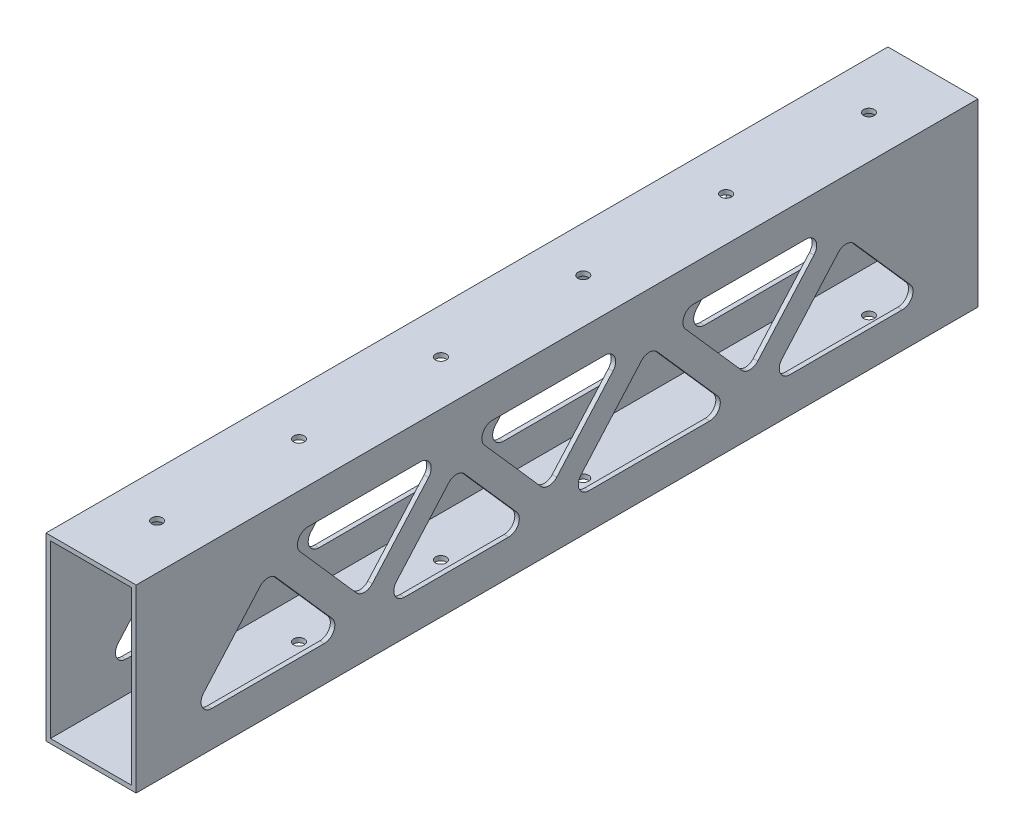
from build123d import *

# Parameters (mm, degrees)
SKETCH1_W           = 25.4
SKETCH1_H           = 50.8
SKETCH1_W_2         = 22.86
SKETCH1_H_2         = 48.26
BOSS_EXTRUDE1_DEPTH = 237.2995
CUT_EXTRUDE1_DEPTH  = 242.549111961
FILLET1_R           = 3
MIRROR1_START       = -91.227065342
MIRROR1_DEPTH       = 1.27
SKETCH6_R           = 1.5
CUT_EXTRUDE2_DEPTH  = 269.69861411


# Read off the part's stored shape, not the designer's step: Mirror1
with BuildPart() as part:
    # Sketch1 → Boss-Extrude1 (new body)
    with BuildSketch(Plane.XY):
        with Locations((-102.657065342, -11.879495554)):
            Rectangle(SKETCH1_W, SKETCH1_H)
        with Locations((-102.657065342, -11.879495554)):
            Rectangle(SKETCH1_W_2, SKETCH1_H_2, mode=Mode.SUBTRACT)
    extrude(amount=BOSS_EXTRUDE1_DEPTH)

    # Sketch5 → Cut-Extrude1 (cut, through all)
    with BuildSketch(Plane.ZY.offset(115.357065342)):
        Polygon((59.65825413, -27.279495554), (37.1624375, -1.771064943), (14.66662087, -27.279495554), align=None)
        Polygon((68.99149587, -27.279495554), (92.653967718, -0.448172595), (116.316439565, -27.279495554), align=None)
        Polygon((98.487243806, 3.520504446), (143.478877065, 3.520504446), (120.983060435, -21.987926165), align=None)
        Polygon((125.649681306, -27.279495554), (146.978842718, -3.09395729), (168.30800413, -27.279495554), align=None)
        Polygon((150.47880837, 3.520504446), (195.47044163, 3.520504446), (172.974625, -21.987926165), align=None)
        Polygon((177.64124587, -27.279495554), (200.1370625, -1.771064943), (222.63287913, -27.279495554), align=None)
        Polygon((41.82905837, 3.520504446), (86.82069163, 3.520504446), (64.324875, -21.987926165), align=None)
    extrude(amount=-CUT_EXTRUDE1_DEPTH, mode=Mode.SUBTRACT)

    # Fillet1
    fillet1_edges = [part.edges().sort_by_distance(p)[0] for p in [
        (-114.722065342, 3.520504446, 41.82905837),
        (-114.722065342, 3.520504446, 86.82069163),
        (-114.722065342, -21.987926165, 64.324875),
        (-114.722065342, -1.771064943, 37.1624375),
        (-114.722065342, -27.279495554, 59.65825413),
        (-114.722065342, -27.279495554, 14.66662087),
        (-114.722065342, -27.279495554, 125.649681306),
        (-114.722065342, -3.09395729, 146.978842718),
        (-114.722065342, -27.279495554, 168.30800413),
        (-114.722065342, 3.520504446, 150.47880837),
        (-114.722065342, 3.520504446, 195.47044163),
        (-114.722065342, -21.987926165, 172.974625),
        (-114.722065342, -27.279495554, 68.99149587),
        (-114.722065342, -0.448172595, 92.653967718),
        (-114.722065342, -27.279495554, 116.316439565),
        (-114.722065342, 3.520504446, 98.487243806),
        (-114.722065342, 3.520504446, 143.478877065),
        (-114.722065342, -21.987926165, 120.983060435),
        (-114.722065342, -27.279495554, 177.64124587),
        (-114.722065342, -1.771064943, 200.1370625),
        (-114.722065342, -27.279495554, 222.63287913),
    ]]
    fillet(fillet1_edges, radius=FILLET1_R)

    # Mirror1 outline → Mirror1 (add)
    with BuildSketch(Plane.YZ.offset(MIRROR1_START)):
        with BuildLine():
            ThreePointArc((-19.436583706, 170.724602919), (-20.45229526, 172.974625), (-19.436583706, 175.224647081))
            Line((-19.436583706, 175.224647081), (-21.987926165, 172.974625))
            Line((-21.987926165, 172.974625), (-19.436583706, 170.724602919))
        make_face()
        with BuildLine():
            Line((3.520504446, 195.47044163), (-1.463784, 191.074811))
            ThreePointArc((-1.463784, 191.074811), (1.754833143, 191.559095535), (3.520504446, 188.824788919))
            Line((3.520504446, 188.824788919), (3.520504446, 195.47044163))
        make_face()
        with BuildLine():
            ThreePointArc((3.520504446, 157.124461081), (1.754833143, 154.390154465), (-1.463784, 154.874439))
            Line((-1.463784, 154.874439), (3.520504446, 150.47880837))
            Line((3.520504446, 150.47880837), (3.520504446, 157.124461081))
        make_face()
        with BuildLine():
            Line((3.520504446, 143.478877065), (-1.463784, 139.083246435))
            ThreePointArc((-1.463784, 139.083246435), (1.754833143, 139.56753097), (3.520504446, 136.833224354))
            Line((3.520504446, 136.833224354), (3.520504446, 143.478877065))
        make_face()
        with BuildLine():
            ThreePointArc((-19.436583706, 118.733038355), (-20.45229526, 120.983060435), (-19.436583706, 123.233082516))
            Line((-19.436583706, 123.233082516), (-21.987926165, 120.983060435))
            Line((-21.987926165, 120.983060435), (-19.436583706, 118.733038355))
        make_face()
        with BuildLine():
            Line((3.520504446, 98.487243806), (3.520504446, 105.132896516))
            ThreePointArc((3.520504446, 105.132896516), (1.754833143, 102.3985899), (-1.463784, 102.882874435))
            Line((-1.463784, 102.882874435), (3.520504446, 98.487243806))
        make_face()
        with BuildLine():
            Line((-27.279495554, 125.649681306), (-22.295207108, 130.045311935))
            ThreePointArc((-22.295207108, 130.045311935), (-25.513824251, 129.5610274), (-27.279495554, 132.295334016))
            Line((-27.279495554, 132.295334016), (-27.279495554, 125.649681306))
        make_face()
        with BuildLine():
            ThreePointArc((-5.645299749, 149.228864798), (-4.629588195, 146.978842718), (-5.645299749, 144.728820637))
            Line((-5.645299749, 144.728820637), (-3.09395729, 146.978842718))
            Line((-3.09395729, 146.978842718), (-5.645299749, 149.228864798))
        make_face()
        with BuildLine():
            Line((-27.279495554, 168.30800413), (-27.279495554, 161.662351419))
            ThreePointArc((-27.279495554, 161.662351419), (-25.513824251, 164.396658035), (-22.295207108, 163.9123735))
            Line((-22.295207108, 163.9123735), (-27.279495554, 168.30800413))
        make_face()
        with BuildLine():
            Line((-27.279495554, 177.64124587), (-22.295207108, 182.0368765))
            ThreePointArc((-22.295207108, 182.0368765), (-25.513824251, 181.552591965), (-27.279495554, 184.286898581))
            Line((-27.279495554, 184.286898581), (-27.279495554, 177.64124587))
        make_face()
        with BuildLine():
            ThreePointArc((-4.322407402, 202.387084581), (-3.306695848, 200.1370625), (-4.322407402, 197.887040419))
            Line((-4.322407402, 197.887040419), (-1.771064943, 200.1370625))
            Line((-1.771064943, 200.1370625), (-4.322407402, 202.387084581))
        make_face()
        with BuildLine():
            Line((-27.279495554, 222.63287913), (-27.279495554, 215.987226419))
            ThreePointArc((-27.279495554, 215.987226419), (-25.513824251, 218.721533035), (-22.295207108, 218.2372485))
            Line((-22.295207108, 218.2372485), (-27.279495554, 222.63287913))
        make_face()
        with BuildLine():
            Line((-27.279495554, 116.316439565), (-27.279495554, 109.670786854))
            ThreePointArc((-27.279495554, 109.670786854), (-25.513824251, 112.40509347), (-22.295207108, 111.920808935))
            Line((-22.295207108, 111.920808935), (-27.279495554, 116.316439565))
        make_face()
        with BuildLine():
            ThreePointArc((-22.295207108, 73.3871265), (-25.513824251, 72.902841965), (-27.279495554, 75.637148581))
            Line((-27.279495554, 75.637148581), (-27.279495554, 68.99149587))
            Line((-27.279495554, 68.99149587), (-22.295207108, 73.3871265))
        make_face()
        with BuildLine():
            Line((-0.448172595, 92.653967718), (-2.999515054, 94.903989798))
            ThreePointArc((-2.999515054, 94.903989798), (-1.9838035, 92.653967717), (-2.999515054, 90.403945637))
            Line((-2.999515054, 90.403945637), (-0.448172595, 92.653967718))
        make_face()
        with BuildLine():
            Line((3.520504446, 86.82069163), (-1.463784, 82.425061))
            ThreePointArc((-1.463784, 82.425061), (1.754833143, 82.909345535), (3.520504446, 80.175038919))
            Line((3.520504446, 80.175038919), (3.520504446, 86.82069163))
        make_face()
        with BuildLine():
            ThreePointArc((-19.436583706, 62.074852919), (-20.45229526, 64.324875), (-19.436583706, 66.574897081))
            Line((-19.436583706, 66.574897081), (-21.987926165, 64.324875))
            Line((-21.987926165, 64.324875), (-19.436583706, 62.074852919))
        make_face()
        with BuildLine():
            Line((3.520504446, 41.82905837), (3.520504446, 48.474711081))
            ThreePointArc((3.520504446, 48.474711081), (1.754833143, 45.740404465), (-1.463784, 46.224689))
            Line((-1.463784, 46.224689), (3.520504446, 41.82905837))
        make_face()
        with BuildLine():
            ThreePointArc((-27.279495554, 53.012601419), (-25.513824251, 55.746908035), (-22.295207108, 55.2626235))
            Line((-22.295207108, 55.2626235), (-27.279495554, 59.65825413))
            Line((-27.279495554, 59.65825413), (-27.279495554, 53.012601419))
        make_face()
        with BuildLine():
            Line((-1.771064943, 37.1624375), (-4.322407402, 39.412459581))
            ThreePointArc((-4.322407402, 39.412459581), (-3.306695848, 37.1624375), (-4.322407402, 34.912415419))
            Line((-4.322407402, 34.912415419), (-1.771064943, 37.1624375))
        make_face()
        with BuildLine():
            ThreePointArc((-22.295207108, 19.0622515), (-25.513824251, 18.577966965), (-27.279495554, 21.312273581))
            Line((-27.279495554, 21.312273581), (-27.279495554, 14.66662087))
            Line((-27.279495554, 14.66662087), (-22.295207108, 19.0622515))
        make_face()
    extrude(amount=MIRROR1_DEPTH)

    # Sketch6 → Cut-Extrude2 (cut, through all)
    with BuildSketch(Plane(origin=(0, 13.520504446, 0), x_dir=(1, 0, 0), z_dir=(0, 1, 0))):
        with Locations(Location((-102.657065342, -138.6915017, 0), (0, 0, 270))):
            Circle(SKETCH6_R)
        with Locations(Location((-102.657065342, -178.6915017, 0), (0, 0, 270))):
            Circle(SKETCH6_R)
        with Locations(Location((-102.657065342, -218.6915017, 0), (0, 0, 270))):
            Circle(SKETCH6_R)
        with Locations(Location((-102.001257873, -18.693437093, 0), (0, 0, 90))):
            Circle(SKETCH6_R)
        with Locations(Location((-102.263580578, -58.692576918, 0), (0, 0, 90))):
            Circle(SKETCH6_R)
        with Locations(Location((-102.525903284, -98.691716744, 0), (0, 0, 90))):
            Circle(SKETCH6_R)
    extrude(amount=-CUT_EXTRUDE2_DEPTH, mode=Mode.SUBTRACT)


solid = part.part
